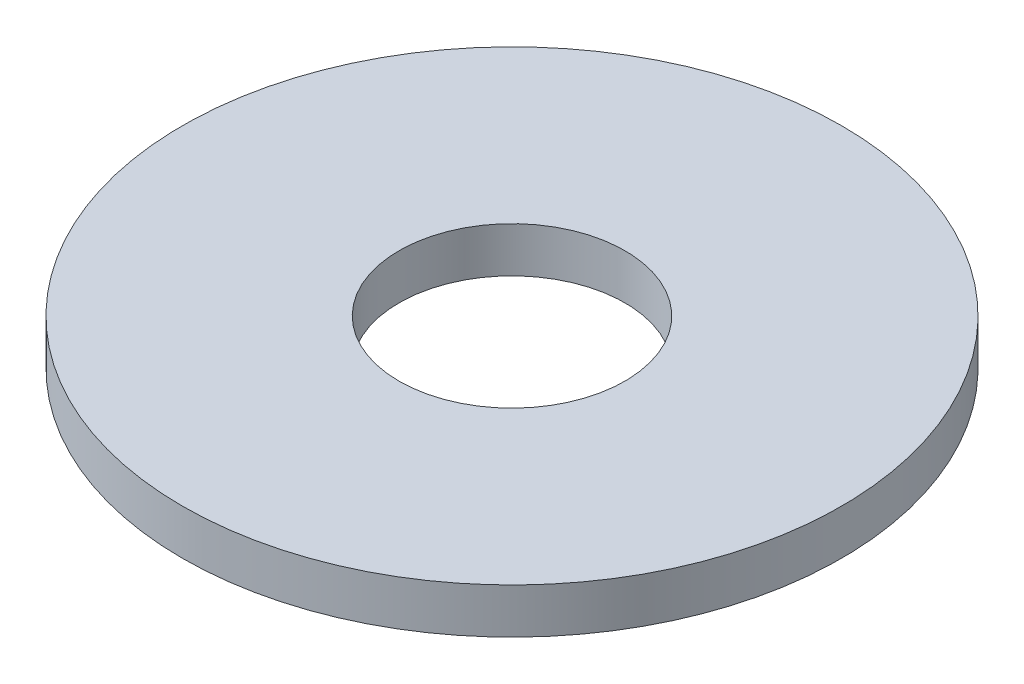
from build123d import *

# Parameters (mm, degrees)
SKETCH1_R           = 87.5
BOSS_EXTRUDE1_DEPTH = 12
SKETCH2_R           = 30
CUT_EXTRUDE1_DEPTH  = 125.324173032


with BuildPart() as part:
    # Sketch1 → Boss-Extrude1 (new body)
    with BuildSketch(Plane(origin=(0, 0, 0), x_dir=(1, 0, 0), z_dir=(0, 1, 0))):
        Circle(SKETCH1_R)
    extrude(amount=BOSS_EXTRUDE1_DEPTH)

    # Sketch2 → Cut-Extrude1 (cut, through all)
    with BuildSketch(Plane(origin=(0, 0, 0), x_dir=(1, 0, 0), z_dir=(0, 1, 0))):
        Circle(SKETCH2_R)
    extrude(amount=CUT_EXTRUDE1_DEPTH, mode=Mode.SUBTRACT)


solid = part.part
